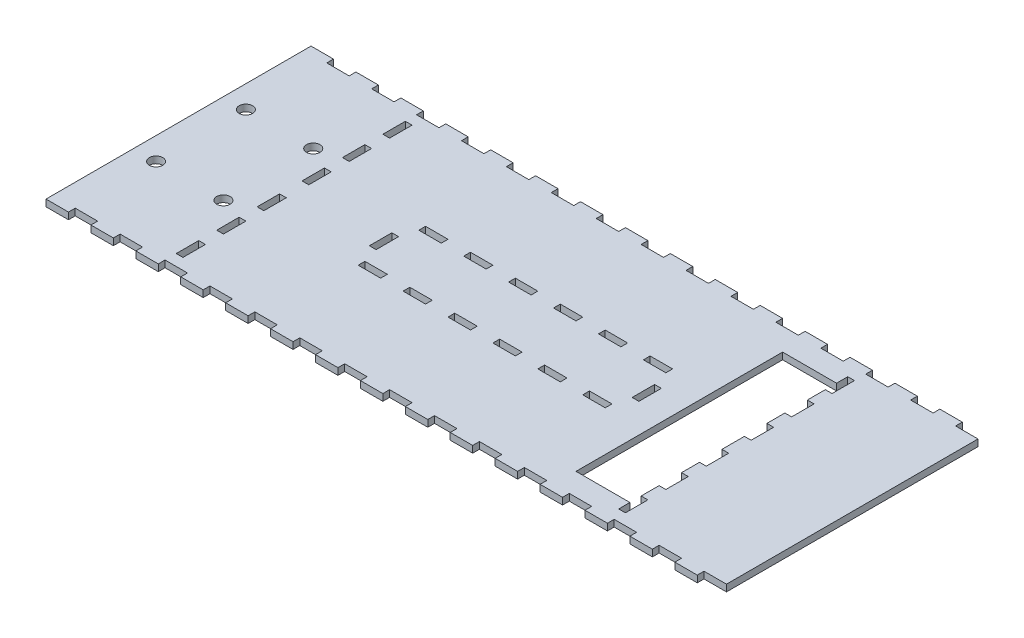
from build123d import *

# Parameters (mm, degrees)
SKETCH3_W           = 3
SKETCH3_H           = 10
SKETCH3_R           = 3
SKETCH3_W_2         = 10
SKETCH3_H_2         = 3
BOSS_EXTRUDE1_DEPTH = 3
SKETCH4_W           = 24
SKETCH4_H           = 92
CUT_EXTRUDE1_DEPTH  = 10


with BuildPart() as part:
    # Sketch3 → Boss-Extrude1 (new body)
    with BuildSketch(Plane(origin=(0, 0, 0), x_dir=(1, 0, 0), z_dir=(0, 1, 0))):
        Polygon((-300, 56), (-300, -56), (-300, -59), (-290, -59), (-290, -56), (-280, -56), (-280, -59), (-270, -59), (-270, -56), (-260, -56), (-260, -59), (-250, -59), (-250, -56), (-240, -56), (-240, -59), (-230, -59), (-230, -56), (-220, -56), (-220, -59), (-210, -59), (-210, -56), (-200, -56), (-200, -59), (-190, -59), (-190, -56), (-180, -56), (-180, -59), (-170, -59), (-170, -56), (-160, -56), (-160, -59), (-150, -59), (-150, -56), (-140, -56), (-140, -59), (-130, -59), (-130, -56), (-120, -56), (-120, -59), (-110, -59), (-110, -56), (-100, -56), (-100, -59), (-90, -59), (-90, -56), (-80, -56), (-80, -59), (-70, -59), (-70, -56), (-60, -56), (-60, -59), (-50, -59), (-50, -56), (-40, -56), (-40, -59), (-30, -59), (-30, -56), (-20, -56), (-20, -59), (-10, -59), (-10, -56), (0, -56), (0, 56), (-10, 56), (-10, 59), (-20, 59), (-20, 56), (-30, 56), (-30, 59), (-40, 59), (-40, 56), (-50, 56), (-50, 59), (-60, 59), (-60, 56), (-70, 56), (-70, 59), (-80, 59), (-80, 56), (-90, 56), (-90, 59), (-100, 59), (-100, 56), (-110, 56), (-110, 59), (-120, 59), (-120, 56), (-130, 56), (-130, 59), (-140, 59), (-140, 56), (-150, 56), (-150, 59), (-160, 59), (-160, 56), (-170, 56), (-170, 59), (-180, 59), (-180, 56), (-190, 56), (-190, 59), (-200, 59), (-200, 56), (-210, 56), (-210, 59), (-220, 59), (-220, 56), (-230, 56), (-230, 59), (-240, 59), (-240, 56), (-250, 56), (-250, 59), (-260, 59), (-260, 56), (-270, 56), (-270, 59), (-280, 59), (-280, 56), (-290, 56), (-290, 59), (-300, 59), align=None)
        with Locations((-248.5, -46)):
            Rectangle(SKETCH3_W, SKETCH3_H, mode=Mode.SUBTRACT)
        with Locations((-290, -20)):
            Circle(SKETCH3_R, mode=Mode.SUBTRACT)
        with Locations((-248.5, -28)):
            Rectangle(SKETCH3_W, SKETCH3_H, mode=Mode.SUBTRACT)
        with Locations((-260, -20)):
            Circle(SKETCH3_R, mode=Mode.SUBTRACT)
        with Locations((-248.5, -10)):
            Rectangle(SKETCH3_W, SKETCH3_H, mode=Mode.SUBTRACT)
        with Locations((-200, -13.5)):
            Rectangle(SKETCH3_W_2, SKETCH3_H_2, mode=Mode.SUBTRACT)
        with Locations((-208.5, 0)):
            Rectangle(SKETCH3_W, SKETCH3_H, mode=Mode.SUBTRACT)
        with Locations((-180, -13.5)):
            Rectangle(SKETCH3_W_2, SKETCH3_H_2, mode=Mode.SUBTRACT)
        with Locations((-160, -13.5)):
            Rectangle(SKETCH3_W_2, SKETCH3_H_2, mode=Mode.SUBTRACT)
        with Locations((-51.5, -46)):
            Rectangle(SKETCH3_W, SKETCH3_H, mode=Mode.SUBTRACT)
        with Locations((-140, -13.5)):
            Rectangle(SKETCH3_W_2, SKETCH3_H_2, mode=Mode.SUBTRACT)
        with Locations((-120, -13.5)):
            Rectangle(SKETCH3_W_2, SKETCH3_H_2, mode=Mode.SUBTRACT)
        with Locations((-100, -13.5)):
            Rectangle(SKETCH3_W_2, SKETCH3_H_2, mode=Mode.SUBTRACT)
        with Locations((-91.5, 0)):
            Rectangle(SKETCH3_W, SKETCH3_H, mode=Mode.SUBTRACT)
        with Locations((-51.5, -28)):
            Rectangle(SKETCH3_W, SKETCH3_H, mode=Mode.SUBTRACT)
        with Locations((-51.5, -10)):
            Rectangle(SKETCH3_W, SKETCH3_H, mode=Mode.SUBTRACT)
        with Locations((-248.5, 10)):
            Rectangle(SKETCH3_W, SKETCH3_H, mode=Mode.SUBTRACT)
        with Locations((-290, 20)):
            Circle(SKETCH3_R, mode=Mode.SUBTRACT)
        with Locations((-260, 20)):
            Circle(SKETCH3_R, mode=Mode.SUBTRACT)
        with Locations((-248.5, 28)):
            Rectangle(SKETCH3_W, SKETCH3_H, mode=Mode.SUBTRACT)
        with Locations((-200, 13.5)):
            Rectangle(SKETCH3_W_2, SKETCH3_H_2, mode=Mode.SUBTRACT)
        with Locations((-180, 13.5)):
            Rectangle(SKETCH3_W_2, SKETCH3_H_2, mode=Mode.SUBTRACT)
        with Locations((-160, 13.5)):
            Rectangle(SKETCH3_W_2, SKETCH3_H_2, mode=Mode.SUBTRACT)
        with Locations((-248.5, 46)):
            Rectangle(SKETCH3_W, SKETCH3_H, mode=Mode.SUBTRACT)
        with Locations((-140, 13.5)):
            Rectangle(SKETCH3_W_2, SKETCH3_H_2, mode=Mode.SUBTRACT)
        with Locations((-120, 13.5)):
            Rectangle(SKETCH3_W_2, SKETCH3_H_2, mode=Mode.SUBTRACT)
        with Locations((-100, 13.5)):
            Rectangle(SKETCH3_W_2, SKETCH3_H_2, mode=Mode.SUBTRACT)
        with Locations((-51.5, 10)):
            Rectangle(SKETCH3_W, SKETCH3_H, mode=Mode.SUBTRACT)
        with Locations((-51.5, 28)):
            Rectangle(SKETCH3_W, SKETCH3_H, mode=Mode.SUBTRACT)
        with Locations((-51.5, 46)):
            Rectangle(SKETCH3_W, SKETCH3_H, mode=Mode.SUBTRACT)
    extrude(amount=BOSS_EXTRUDE1_DEPTH)

    # Sketch4 → Cut-Extrude1 (cut)
    with BuildSketch(Plane(origin=(0, 3, 0), x_dir=(1, 0, 0), z_dir=(0, 1, 0))):
        with Locations((-65, 0)):
            Rectangle(SKETCH4_W, SKETCH4_H)
    extrude(amount=-CUT_EXTRUDE1_DEPTH, mode=Mode.SUBTRACT)


solid = part.part
